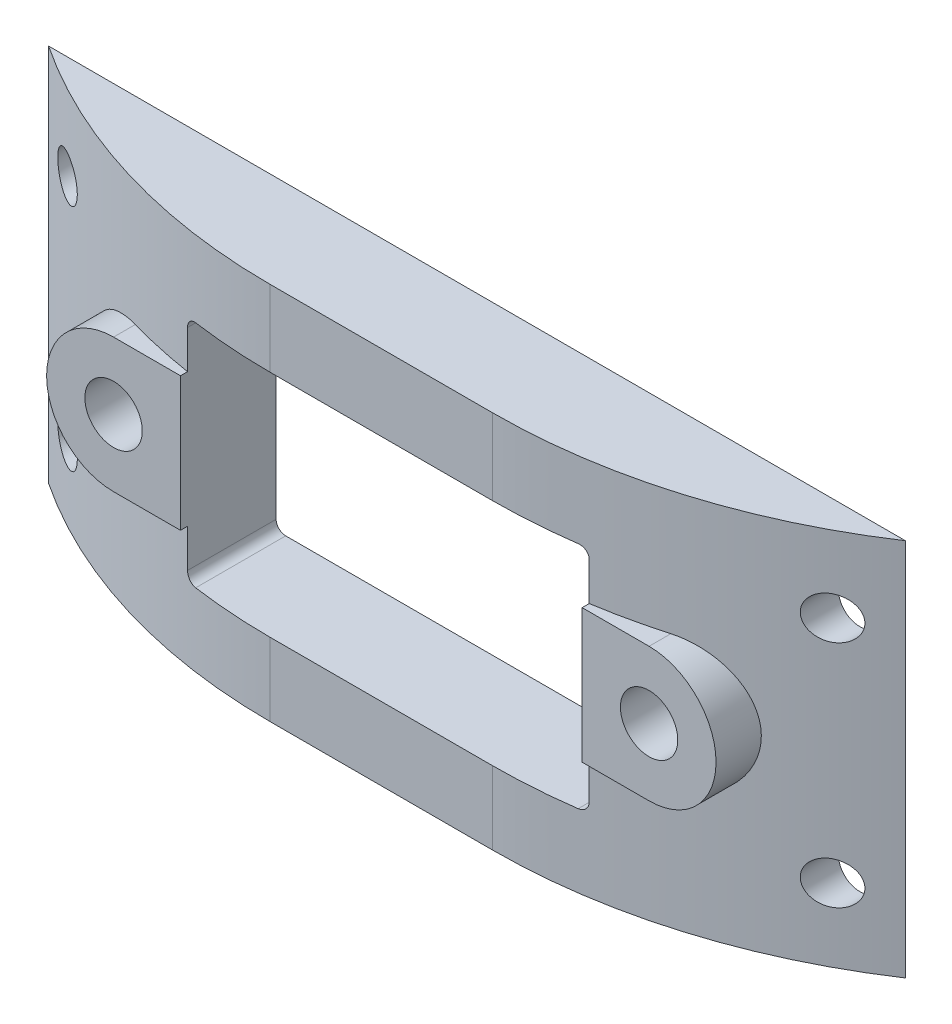
from build123d import *

# Parameters (mm, degrees)
SKETCH1_W           = 44.8
SKETCH1_H           = 19.8
BOSS_EXTRUDE1_DEPTH = 5
SKETCH2_R           = 1.1
CUT_EXTRUDE1_DEPTH  = 13
SKETCH3_R           = 1.5
CUT_EXTRUDE2_DEPTH  = 10
SKETCH4_W           = 21
SKETCH4_H           = 12
CUT_EXTRUDE3_DEPTH  = 10
FILLET1_START       = 9.18
FILLET1_DEPTH       = 19.8
BOSS_EXTRUDE2_START = -5
SKETCH5_R           = 3.5
SKETCH5_R_2         = 1.5
BOSS_EXTRUDE2_DEPTH = 5
FILLET2_R           = 0.5


with BuildPart() as part:
    # Sketch1 → Boss-Extrude1 (new body)
    with BuildSketch(Plane.XY):
        with Locations((0, 19.08)):
            Rectangle(SKETCH1_W, SKETCH1_H)
    extrude(amount=BOSS_EXTRUDE1_DEPTH)

    # Sketch2 → Cut-Extrude1 (cut)
    with BuildSketch(Plane.XY.offset(5)):
        with Locations((-20, 25)):
            Circle(SKETCH2_R)
        with Locations((-20, 13)):
            Circle(SKETCH2_R)
        with Locations((20, 25)):
            Circle(SKETCH2_R)
        with Locations((20, 13)):
            Circle(SKETCH2_R)
    extrude(amount=-CUT_EXTRUDE1_DEPTH, mode=Mode.SUBTRACT)

    # Sketch3 → Cut-Extrude2 (cut)
    with BuildSketch(Plane.XY.offset(5)):
        with Locations((-14, 19)):
            Circle(SKETCH3_R)
        with Locations((14, 19)):
            Circle(SKETCH3_R)
    extrude(amount=-CUT_EXTRUDE2_DEPTH, mode=Mode.SUBTRACT)

    # Sketch4 → Cut-Extrude3 (cut)
    with BuildSketch(Plane.XY.offset(5)):
        with Locations((0, 19)):
            Rectangle(SKETCH4_W, SKETCH4_H)
    extrude(amount=-CUT_EXTRUDE3_DEPTH, mode=Mode.SUBTRACT)

    # Fillet1: read off the stored shape, not the designer's step
    # Fillet1 outline → Fillet1 (cut)
    with BuildSketch(Plane(origin=(0, 0, 0), x_dir=(1, 0, 0), z_dir=(0, 1, 0)).offset(FILLET1_START)):
        with BuildLine():
            Line((22.4, -5), (22.4, 0))
            ThreePointArc((22.4, 0), (14.477130086, -3.722813233), (5.816876048, -5))
            Line((5.816876048, -5), (22.4, -5))
        make_face()
        with BuildLine():
            Line((-22.4, -5), (-5.816876048, -5))
            ThreePointArc((-5.816876048, -5), (-14.477130086, -3.722813233), (-22.4, 0))
            Line((-22.4, 0), (-22.4, -5))
        make_face()
    extrude(amount=FILLET1_DEPTH, mode=Mode.SUBTRACT)

    # Sketch5 → Boss-Extrude2 (add)
    # profile 1 of 6: a face of its own
    with BuildSketch(Plane(origin=(0, 0, 0), x_dir=(-1, 0, 0), z_dir=(0, 0, -1)).offset(BOSS_EXTRUDE2_START)):
        with Locations((-14, 19)):
            Circle(SKETCH5_R)
        with Locations((-14, 19)):
            Circle(SKETCH5_R_2, mode=Mode.SUBTRACT)
    # profile 2 of 6: a face of its own
    with BuildSketch(Plane(origin=(0, 0, 0), x_dir=(-1, 0, 0), z_dir=(0, 0, -1)).offset(BOSS_EXTRUDE2_START)):
        with BuildLine():
            Line((-10.5, 22.5), (-14, 22.5))
            ThreePointArc((-14, 22.5), (-11.525126266, 21.474873734), (-10.5, 19))
            Line((-10.5, 19), (-10.5, 22.5))
        make_face()
    # profile 3 of 6: a face of its own
    with BuildSketch(Plane(origin=(0, 0, 0), x_dir=(-1, 0, 0), z_dir=(0, 0, -1)).offset(BOSS_EXTRUDE2_START)):
        with BuildLine():
            Line((-10.5, 15.5), (-10.5, 19))
            ThreePointArc((-10.5, 19), (-11.525126266, 16.525126266), (-14, 15.5))
            Line((-14, 15.5), (-10.5, 15.5))
        make_face()
    # profile 4 of 6: a face of its own
    with BuildSketch(Plane(origin=(0, 0, 0), x_dir=(-1, 0, 0), z_dir=(0, 0, -1)).offset(BOSS_EXTRUDE2_START)):
        with Locations((14, 19)):
            Circle(SKETCH5_R)
        with Locations((14, 19)):
            Circle(SKETCH5_R_2, mode=Mode.SUBTRACT)
    # profile 5 of 6: a face of its own
    with BuildSketch(Plane(origin=(0, 0, 0), x_dir=(-1, 0, 0), z_dir=(0, 0, -1)).offset(BOSS_EXTRUDE2_START)):
        with BuildLine():
            ThreePointArc((14, 15.5), (11.525126266, 16.525126266), (10.5, 19))
            Line((10.5, 19), (10.5, 15.5))
            Line((10.5, 15.5), (14, 15.5))
        make_face()
    # profile 6 of 6: a face of its own
    with BuildSketch(Plane(origin=(0, 0, 0), x_dir=(-1, 0, 0), z_dir=(0, 0, -1)).offset(BOSS_EXTRUDE2_START)):
        with BuildLine():
            ThreePointArc((10.5, 19), (11.525126266, 21.474873734), (14, 22.5))
            Line((14, 22.5), (10.5, 22.5))
            Line((10.5, 22.5), (10.5, 19))
        make_face()
    extrude(amount=BOSS_EXTRUDE2_DEPTH)

    # Fillet2
    fillet2_edges = [part.edges().sort_by_distance(p)[0] for p in [
        (-10.5, 13, 2.316109055),
        (-10.5, 25, 2.316109055),
        (10.5, 25, 2.316109055),
        (10.5, 13, 2.316109055),
    ]]
    fillet(fillet2_edges, radius=FILLET2_R)


solid = part.part
